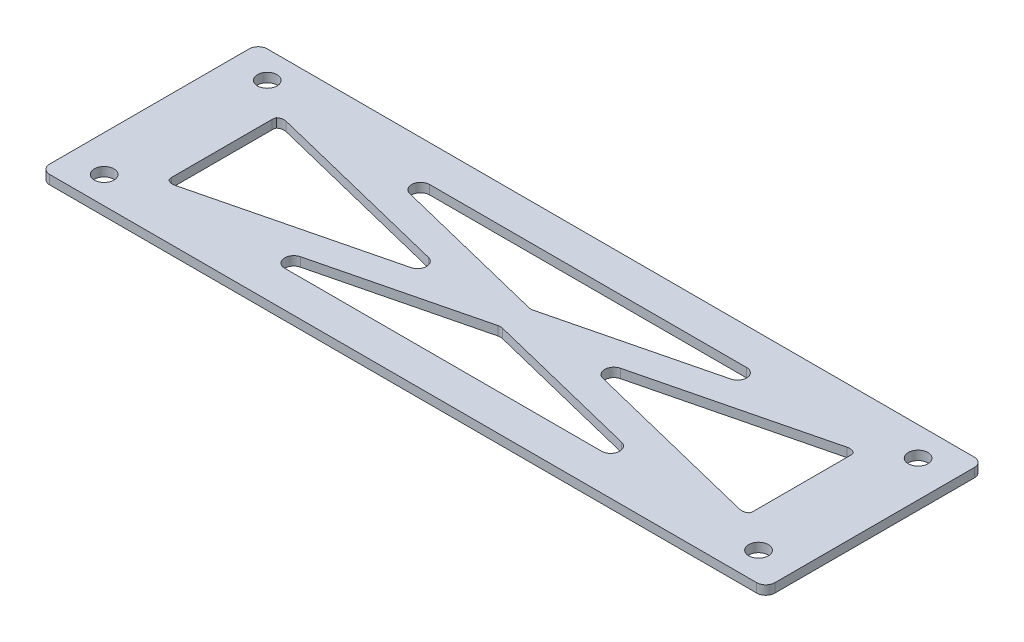
from build123d import *

# Parameters (mm, degrees)
SKETCH1_W           = 254
SKETCH1_H           = 76.2
SKETCH1_R           = 3.429
BOSS_EXTRUDE1_DEPTH = 3.175
FILLET1_R           = 3.175
CUT_EXTRUDE1_DEPTH  = 133.629900946
FILLET3_R           = 3.175


with BuildPart() as part:
    # Sketch1 → Boss-Extrude1 (new body)
    with BuildSketch(Plane(origin=(0, 0, 0), x_dir=(1, 0, 0), z_dir=(0, 1, 0))):
        Rectangle(SKETCH1_W, SKETCH1_H)
        with Locations(Location((-114.3, 28.575, 0), (0, 0, 270))):
            Circle(SKETCH1_R, mode=Mode.SUBTRACT)
        with Locations(Location((-114.3, -28.575, 0), (0, 0, 270))):
            Circle(SKETCH1_R, mode=Mode.SUBTRACT)
        with Locations(Location((114.3, 27.94, 0), (0, 0, 270))):
            Circle(SKETCH1_R, mode=Mode.SUBTRACT)
        with Locations(Location((114.3, -27.94, 0), (0, 0, 270))):
            Circle(SKETCH1_R, mode=Mode.SUBTRACT)
    extrude(amount=BOSS_EXTRUDE1_DEPTH)

    # Fillet1
    fillet1_edges = [part.edges().sort_by_distance(p)[0] for p in [
        (127, 1.5875, 38.1),
        (-127, 1.5875, 38.1),
        (-127, 1.5875, -38.1),
        (127, 1.5875, -38.1),
    ]]
    fillet(fillet1_edges, radius=FILLET1_R)

    # Sketch2 → Cut-Extrude1 (cut, through all)
    with BuildSketch(Plane(origin=(0, 3.175, 0), x_dir=(1, 0, 0), z_dir=(0, 1, 0))):
        with BuildLine():
            ThreePointArc((-100.658473406, 19.969571877), (-101.112278779, 19.289061706), (-101.6, 18.632432877))
            Line((-101.6, 18.632432877), (-101.6, -18.632432877))
            ThreePointArc((-101.6, -18.632432877), (-101.112278779, -19.289061706), (-100.658473406, -19.969571877))
            Line((-100.658473406, -19.969571877), (-19.882677051, 0))
            Line((-19.882677051, 0), (-100.658473406, 19.969571877))
        make_face()
        Polygon((82.858895983, 25.4), (-80.290356657, 25.4), (1.284269663, 5.232939604), align=None)
        Polygon((82.858895983, -25.4), (1.284269663, -5.232939604), (-80.290356657, -25.4), align=None)
        with BuildLine():
            Line((100.658473406, 19.334571877), (22.451216377, 0))
            Line((22.451216377, 0), (100.658473406, -19.334571877))
            ThreePointArc((100.658473406, -19.334571877), (101.112278779, -18.654061706), (101.6, -17.997432877))
            Line((101.6, -17.997432877), (101.6, 17.997432877))
            ThreePointArc((101.6, 17.997432877), (101.112278779, 18.654061706), (100.658473406, 19.334571877))
        make_face()
    extrude(amount=-CUT_EXTRUDE1_DEPTH, mode=Mode.SUBTRACT)

    # Fillet3
    # the kernel refuses this fillet: 3.175 mm, written as the material it adds along each edge
    with BuildSketch(Plane(origin=(100.658473406, 3.175, 19.334571877), x_dir=(-0.9707736729696135, 0, -0.23999682470625738), z_dir=(0, -1, 0)), Plane(origin=(-100.658473406, 3.175, -19.969571877), x_dir=(0.9707736729696127, 0, 0.23999682470626046), z_dir=(0, -1, 0))) as fillet3_piece_1:
        with BuildLine():
            CenterArc((2.141800615, 3.175), FILLET3_R, 205.317347828, 64.682652172)
            ThreePointArc((-0.728250522, 1.817269737), (-0.336527011, 0.919694558), (0, 0))
            Line((0, 0), (2.141800615, 0))
        make_face()
    extrude(amount=3.175)
    with BuildSketch(Plane(origin=(22.451216377, 3.175, 0), x_dir=(0.9707736729695857, 0, -0.23999682470636963), z_dir=(0, -1, 0)), Plane(origin=(-19.882677051, 3.175, 0), x_dir=(-0.9707736729695856, 0, 0.23999682470636988), z_dir=(0, -1, 0))) as fillet3_piece_2:
        with BuildLine():
            CenterArc((FILLET3_R * 4.04494382022, FILLET3_R), FILLET3_R, 117.772705909, 152.227294091)
            Line((FILLET3_R * 3.57897862218, FILLET3_R * 1.88480304826), (0, 0))
            Line((0, 0), (FILLET3_R * 4.04494382022, 0))
        make_face()
    extrude(amount=3.175)
    with BuildSketch(Plane(origin=(100.658473406, 3.175, -19.334571877), x_dir=(-0.970773672969613, 0, 0.23999682470625897), z_dir=(0, -1, 0))) as fillet3_piece_3:
        with BuildLine():
            CenterArc((2.141800615, -3.175), FILLET3_R, 90, 64.682652172)
            ThreePointArc((-0.728250522, -1.817269737), (-0.336527011, -0.919694558), (0, 0))
            Line((0, 0), (2.141800615, 0))
        make_face()
    extrude(amount=3.175)
    with BuildSketch(Plane(origin=(82.858895983, 3.175, -25.4), x_dir=(-0.9707736729695856, 0, 0.23999682470636996), z_dir=(0, -1, 0)), Plane(origin=(-80.290356657, 3.175, 25.4), x_dir=(0.9707736729695856, 0, -0.23999682470636974), z_dir=(0, -1, 0)), Plane(origin=(-80.290356657, 3.175, -25.4), x_dir=(1, 0, 0), z_dir=(0, -1, 0))) as fillet3_piece_4:
        with BuildLine():
            CenterArc((FILLET3_R * 8.21166561425, FILLET3_R), FILLET3_R, 103.886352954, 166.113647046)
            Line((FILLET3_R * 7.97166878954, FILLET3_R * 1.97077367297), (0, 0))
            Line((0, 0), (FILLET3_R * 8.21166561425, 0))
        make_face()
    extrude(amount=3.175)
    with BuildSketch(Plane(origin=(82.858895983, 3.175, 25.4), x_dir=(-0.9707736729695857, 0, -0.2399968247063698), z_dir=(0, -1, 0))) as fillet3_piece_5:
        with BuildLine():
            CenterArc((FILLET3_R * 8.21166561425, -FILLET3_R), FILLET3_R, 90, 166.113647046)
            Line((FILLET3_R * 7.97166878954, -FILLET3_R * 1.97077367297), (0, 0))
            Line((0, 0), (FILLET3_R * 8.21166561425, 0))
        make_face()
    extrude(amount=3.175)
    with BuildSketch(Plane(origin=(-100.658473406, 3.175, 19.969571877), x_dir=(-0.5838848021252715, 0, -0.811836521626819), z_dir=(0, -1, 0))) as fillet3_piece_6:
        with BuildLine():
            CenterArc((2.150451203, 3.169147283), FILLET3_R, 201.837892452, 64.682652172)
            Line((-0.796710862, 1.988105047), (0, 0))
            ThreePointArc((0, 0), (0.978879221, 0.029731803), (1.957758443, 0))
        make_face()
    extrude(amount=3.175)
    with BuildSketch(Plane(origin=(1.284269663, 3.175, -5.232939604), x_dir=(0.9707736729695848, 0, -0.23999682470637296), z_dir=(0, -1, 0))) as fillet3_piece_7:
        with BuildLine():
            CenterArc((FILLET3_R * 0.247222222222, -FILLET3_R), FILLET3_R, 90, 27.772705909)
            Line((-FILLET3_R * 0.21874297582, -FILLET3_R * 0.115196951738), (0, 0))
            Line((0, 0), (FILLET3_R * 0.247222222222, 0))
        make_face()
    extrude(amount=3.175)
    with BuildSketch(Plane(origin=(1.284269663, 3.175, 5.232939604), x_dir=(0.9707736729695816, 0, 0.23999682470638586), z_dir=(0, -1, 0))) as fillet3_piece_8:
        with BuildLine():
            CenterArc((FILLET3_R * 0.247222222222, FILLET3_R), FILLET3_R, 242.227294091, 27.772705909)
            Line((-FILLET3_R * 0.21874297582, FILLET3_R * 0.115196951738), (0, 0))
            Line((0, 0), (FILLET3_R * 0.247222222222, 0))
        make_face()
    extrude(amount=3.175)
    with BuildSketch(Plane(origin=(101.6, 3.175, -17.997432877), x_dir=(0, 0, 1), z_dir=(0, -1, 0)), Plane(origin=(-101.6, 3.175, 18.632432877), x_dir=(0, 0, -1), z_dir=(0, -1, 0))) as fillet3_piece_9:
        with BuildLine():
            CenterArc((1.040546779, 3.175), FILLET3_R, 235.322589412, 34.677410588)
            ThreePointArc((-0.765886428, 0.563980263), (-0.378785041, 0.28763694), (0, 0))
            Line((0, 0), (1.040546779, 0))
        make_face()
    extrude(amount=3.175)
    with BuildSketch(Plane(origin=(101.6, 3.175, 17.997432877), x_dir=(-0.5929556750159476, 0, 0.8052351007416294), z_dir=(0, -1, 0))) as fillet3_piece_10:
        with BuildLine():
            CenterArc((1.044749477, 3.173619563), FILLET3_R, 233.63296639, 34.677410588)
            Line((-0.837884791, 0.616998118), (0, 0))
            ThreePointArc((0, 0), (0.475566966, 0.007012621), (0.951133933, 0))
        make_face()
    extrude(amount=3.175)
    with BuildSketch(Plane(origin=(-101.6, 3.175, -18.632432877), x_dir=(0, 0, 1), z_dir=(0, -1, 0))) as fillet3_piece_11:
        with BuildLine():
            CenterArc((1.040546779, -3.175), FILLET3_R, 90, 34.677410588)
            ThreePointArc((-0.765886428, -0.563980263), (-0.378785041, -0.28763694), (0, 0))
            Line((0, 0), (1.040546779, 0))
        make_face()
    extrude(amount=3.175)


solid = part.part
